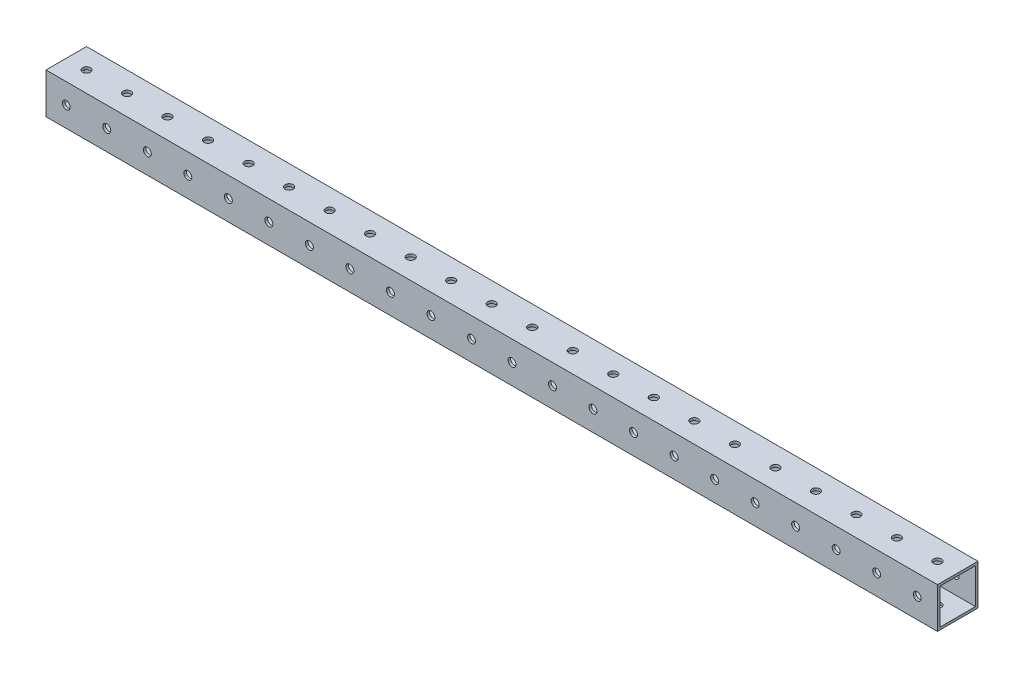
from build123d import *

# Parameters (mm, degrees)
SKETCH1_W             = 25.4
SKETCH1_H             = 25.4
SKETCH1_W_2           = 22.225
SKETCH1_H_2           = 22.225
BOSS_EXTRUDE1_DEPTH   = 279.4
SKETCH3_W             = 2.4892
SKETCH3_H             = 25.4
SKETCH3_AT_POINT_2_W  = 2.4892
SKETCH3_AT_POINT_2_H  = 25.4
LPATTERN1_START       = -12.7
LPATTERN1_OUTLINE_R   = 2.4892
LPATTERN1_DEPTH       = 25.4
LPATTERN1_2_OUTLINE_R = 2.4892
LPATTERN1_2_DEPTH     = 25.4


# Read off the part's stored shape, not the designer's step: LPattern1
with BuildPart() as part:
    # Sketch1 → Boss-Extrude1 (new, symmetric)
    with BuildSketch(Plane(origin=(0, 0, 0), x_dir=(0, 0, -1), z_dir=(1, 0, 0))):
        Rectangle(SKETCH1_W, SKETCH1_H)
        Rectangle(SKETCH1_W_2, SKETCH1_H_2, mode=Mode.SUBTRACT)
    extrude(amount=BOSS_EXTRUDE1_DEPTH, both=True)

    # Sketch3 → #9 (0.196) Diameter Hole1 (revolve, cut)
    with BuildSketch(Plane(origin=(266.7, 12.7, 0), x_dir=(0, 0, 1), z_dir=(1, 0, 0))):
        with Locations((1.2446, 12.7)):
            Rectangle(SKETCH3_W, SKETCH3_H)
    revolve(axis=Axis((266.7, 19.05, 0), (0, -1, 0)), mode=Mode.SUBTRACT)

    # Sketch3 at point 2 (carried to point 2, square into its face) → #9 (0.196) Diameter Hole1 at 2 (revolve, cut)
    with BuildSketch(Plane(origin=(266.7, 0, 12.7), x_dir=(0, -1, 0), z_dir=(1, 0, 0))):
        with Locations((1.2446, 12.7)):
            Rectangle(SKETCH3_AT_POINT_2_W, SKETCH3_AT_POINT_2_H)
    revolve(axis=Axis((266.7, 0, 19.05), (0, 0, -1)), mode=Mode.SUBTRACT)

    # LPattern1 outline → LPattern1 (cut)
    with BuildSketch(Plane.XY.offset(LPATTERN1_START)):
        with Locations((241.3, 0)):
            Circle(LPATTERN1_OUTLINE_R)
        with Locations((215.9, 0)):
            Circle(LPATTERN1_OUTLINE_R)
        with Locations((190.5, 0)):
            Circle(LPATTERN1_OUTLINE_R)
        with Locations((165.1, 0)):
            Circle(LPATTERN1_OUTLINE_R)
        with Locations((139.7, 0)):
            Circle(LPATTERN1_OUTLINE_R)
        with Locations((114.3, 0)):
            Circle(LPATTERN1_OUTLINE_R)
        with Locations((88.9, 0)):
            Circle(LPATTERN1_OUTLINE_R)
        with Locations((63.5, 0)):
            Circle(LPATTERN1_OUTLINE_R)
        with Locations((38.1, 0)):
            Circle(LPATTERN1_OUTLINE_R)
        with Locations((12.7, 0)):
            Circle(LPATTERN1_OUTLINE_R)
        with Locations((-12.7, 0)):
            Circle(LPATTERN1_OUTLINE_R)
        with Locations((-38.1, 0)):
            Circle(LPATTERN1_OUTLINE_R)
        with Locations((-63.5, 0)):
            Circle(LPATTERN1_OUTLINE_R)
        with Locations((-88.9, 0)):
            Circle(LPATTERN1_OUTLINE_R)
        with Locations((-114.3, 0)):
            Circle(LPATTERN1_OUTLINE_R)
        with Locations((-139.7, 0)):
            Circle(LPATTERN1_OUTLINE_R)
        with Locations((-165.1, 0)):
            Circle(LPATTERN1_OUTLINE_R)
        with Locations((-190.5, 0)):
            Circle(LPATTERN1_OUTLINE_R)
        with Locations((-215.9, 0)):
            Circle(LPATTERN1_OUTLINE_R)
        with Locations((-241.3, 0)):
            Circle(LPATTERN1_OUTLINE_R)
        with Locations((-266.7, 0)):
            Circle(LPATTERN1_OUTLINE_R)
    extrude(amount=LPATTERN1_DEPTH, mode=Mode.SUBTRACT)

    # LPattern1 2 outline → LPattern1 2 (cut)
    with BuildSketch(Plane(origin=(0, 0, 0), x_dir=(1, 0, 0), z_dir=(0, 1, 0)).offset(LPATTERN1_START)):
        with Locations((241.3, 0)):
            Circle(LPATTERN1_2_OUTLINE_R)
        with Locations((215.9, 0)):
            Circle(LPATTERN1_2_OUTLINE_R)
        with Locations((190.5, 0)):
            Circle(LPATTERN1_2_OUTLINE_R)
        with Locations((165.1, 0)):
            Circle(LPATTERN1_2_OUTLINE_R)
        with Locations((139.7, 0)):
            Circle(LPATTERN1_2_OUTLINE_R)
        with Locations((114.3, 0)):
            Circle(LPATTERN1_2_OUTLINE_R)
        with Locations((88.9, 0)):
            Circle(LPATTERN1_2_OUTLINE_R)
        with Locations((63.5, 0)):
            Circle(LPATTERN1_2_OUTLINE_R)
        with Locations((38.1, 0)):
            Circle(LPATTERN1_2_OUTLINE_R)
        with Locations((12.7, 0)):
            Circle(LPATTERN1_2_OUTLINE_R)
        with Locations((-12.7, 0)):
            Circle(LPATTERN1_2_OUTLINE_R)
        with Locations((-38.1, 0)):
            Circle(LPATTERN1_2_OUTLINE_R)
        with Locations((-63.5, 0)):
            Circle(LPATTERN1_2_OUTLINE_R)
        with Locations((-88.9, 0)):
            Circle(LPATTERN1_2_OUTLINE_R)
        with Locations((-114.3, 0)):
            Circle(LPATTERN1_2_OUTLINE_R)
        with Locations((-139.7, 0)):
            Circle(LPATTERN1_2_OUTLINE_R)
        with Locations((-165.1, 0)):
            Circle(LPATTERN1_2_OUTLINE_R)
        with Locations((-190.5, 0)):
            Circle(LPATTERN1_2_OUTLINE_R)
        with Locations((-215.9, 0)):
            Circle(LPATTERN1_2_OUTLINE_R)
        with Locations((-241.3, 0)):
            Circle(LPATTERN1_2_OUTLINE_R)
        with Locations((-266.7, 0)):
            Circle(LPATTERN1_2_OUTLINE_R)
    extrude(amount=LPATTERN1_2_DEPTH, mode=Mode.SUBTRACT)


solid = part.part
